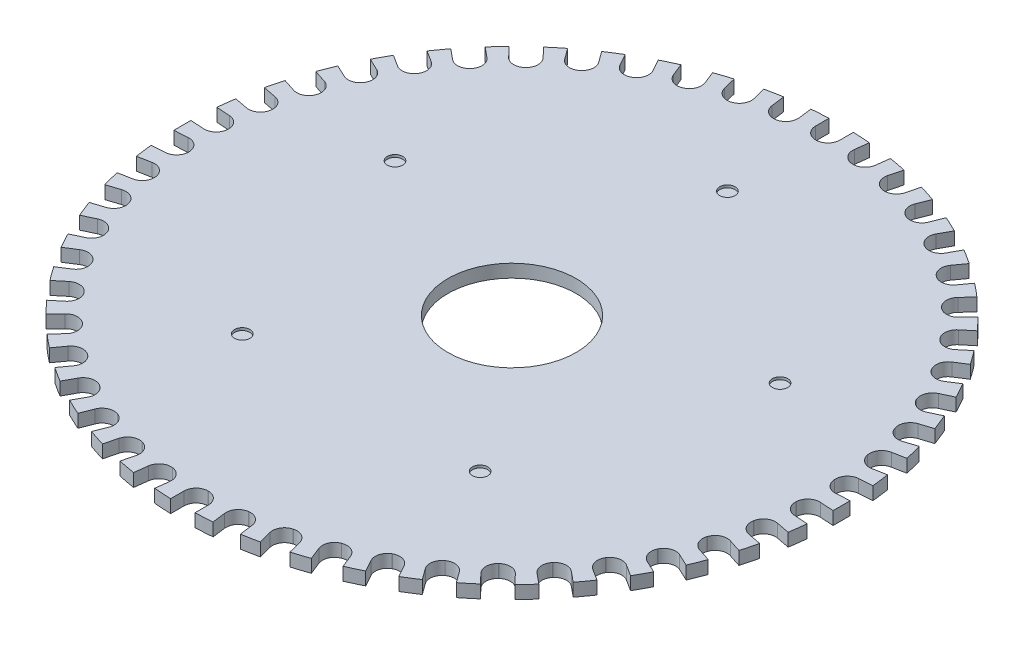
from build123d import *

# Parameters (mm, degrees)
RESSALTO_EXTRUS_O1_DEPTH = 0.2529
ESBO_O2_R                = 2.5
CORTE_EXTRUS_O1_DEPTH    = 19.173605411
ESBO_O3_R                = 0.3
CORTE_EXTRUS_O2_DEPTH    = 0.1


with BuildPart() as part:
    # Esboço1 → Ressalto-extrusão1 (new, symmetric)
    with BuildSketch(Plane(origin=(0, 0, 0), x_dir=(1, 0, 0), z_dir=(0, 1, 0))):
        with BuildLine():
            Line((1.067890513, 12.283014119), (1.133192992, 12.79993647))
            ThreePointArc((1.133192992, 12.79993647), (0.801864568, 12.824956655), (0.47, 12.841401793))
            Line((0.47, 12.841401793), (0.47, 12.320001055))
            ThreePointArc((0.47, 12.320001055), (0.332340187, 11.987660868), (0, 11.850001055))
            Line((0, 11.850001055), (-0.01, 11.850001055))
            ThreePointArc((-0.01, 11.850001055), (-0.342340187, 11.987660868), (-0.48, 12.320001055))
            Line((-0.48, 12.320001055), (-0.48, 12.84103189))
            ThreePointArc((-0.48, 12.84103189), (-0.811851661, 12.824328321), (-1.143160501, 12.799050124))
            Line((-1.143160501, 12.799050124), (-1.07781166, 12.281760787))
            ThreePointArc((-1.07781166, 12.281760787), (-1.172732714, 11.934787852), (-1.48519895, 11.756560257))
            Line((-1.48519895, 11.756560257), (-1.495120097, 11.755306925))
            ThreePointArc((-1.495120097, 11.755306925), (-1.842093032, 11.850227979), (-2.020320626, 12.162694215))
            Line((-2.020320626, 12.162694215), (-2.085623106, 12.679616566))
            ThreePointArc((-2.085623106, 12.679616566), (-2.412764505, 12.621452668), (-2.738292677, 12.554849789))
            Line((-2.738292677, 12.554849789), (-2.608625586, 12.049829814))
            ThreePointArc((-2.608625586, 12.049829814), (-2.65931092, 11.693696101), (-2.946975425, 11.477711481))
            Line((-2.946975425, 11.477711481), (-2.956661257, 11.475224582))
            ThreePointArc((-2.956661257, 11.475224582), (-3.312794969, 11.525909915), (-3.52877959, 11.813574421))
            Line((-3.52877959, 11.813574421), (-3.658354689, 12.318236114))
            ThreePointArc((-3.658354689, 12.318236114), (-3.975626611, 12.219529166), (-4.290240342, 12.112651972))
            Line((-4.290240342, 12.112651972), (-4.098299929, 11.627865827))
            ThreePointArc((-4.098299929, 11.627865827), (-4.103950203, 11.268187778), (-4.362276338, 11.017852339))
            Line((-4.362276338, 11.017852339), (-4.371574102, 11.014171093))
            ThreePointArc((-4.371574102, 11.014171093), (-4.731252151, 11.019821367), (-4.981587591, 11.278147502))
            Line((-4.981587591, 11.278147502), (-5.173391834, 11.762589721))
            ThreePointArc((-5.173391834, 11.762589721), (-5.475790711, 11.62489639), (-5.774528355, 11.479430399))
            Line((-5.774528355, 11.479430399), (-5.523341633, 11.022523449))
            ThreePointArc((-5.523341633, 11.022523449), (-5.483867741, 10.664973403), (-5.708781546, 10.384235083))
            Line((-5.708781546, 10.384235083), (-5.717544613, 10.379417546))
            ThreePointArc((-5.717544613, 10.379417546), (-6.07509466, 10.339943654), (-6.35583298, 10.564857459))
            Line((-6.35583298, 10.564857459), (-6.606841499, 11.02144026))
            ThreePointArc((-6.606841499, 11.02144026), (-6.88959832, 10.846932054), (-7.167748605, 10.66517135))
            Line((-7.167748605, 10.66517135), (-6.861276941, 10.243349293))
            ThreePointArc((-6.861276941, 10.243349293), (-6.777301408, 9.893566026), (-6.96525586, 9.586852237))
            Line((-6.96525586, 9.586852237), (-6.97334603, 9.580974384))
            ThreePointArc((-6.97334603, 9.580974384), (-7.323129297, 9.496998851), (-7.629843086, 9.684953303))
            Line((-7.629843086, 9.684953303), (-7.936097326, 10.106476103))
            ThreePointArc((-7.936097326, 10.106476103), (-8.194752848, 9.897905119), (-8.447929178, 9.682716179))
            Line((-8.447929178, 9.682716179), (-8.091005812, 9.302631399))
            ThreePointArc((-8.091005812, 9.302631399), (-7.963852984, 8.966131202), (-8.111883927, 8.638279004))
            Line((-8.111883927, 8.638279004), (-8.119173614, 8.631433533))
            ThreePointArc((-8.119173614, 8.631433533), (-8.45567381, 8.504280704), (-8.783526008, 8.652311648))
            Line((-8.783526008, 8.652311648), (-9.140196159, 9.032126781))
            ThreePointArc((-9.140196159, 9.032126781), (-9.370671229, 8.792782309), (-9.594880862, 8.547558789))
            Line((-9.594880862, 8.547558789), (-9.193134689, 8.21520545))
            ThreePointArc((-9.193134689, 8.21520545), (-9.02480984, 7.897295133), (-9.13058274, 7.553474951))
            Line((-9.13058274, 7.553474951), (-9.13695698, 7.545769818))
            ThreePointArc((-9.13695698, 7.545769818), (-9.454867296, 7.37744497), (-9.798687479, 7.48321787))
            Line((-9.798687479, 7.48321787), (-10.200148637, 7.815335423))
            ThreePointArc((-10.200148637, 7.815335423), (-10.398808526, 7.548992068), (-10.590515542, 7.277601291))
            Line((-10.590515542, 7.277601291), (-10.150282339, 6.998220804))
            ThreePointArc((-10.150282339, 6.998220804), (-9.943440055, 6.703914003), (-10.005286808, 6.349548086))
            Line((-10.005286808, 6.349548086), (-10.010645076, 6.341104806))
            ThreePointArc((-10.010645076, 6.341104806), (-10.304951877, 6.134262522), (-10.659317794, 6.196109275))
            Line((-10.659317794, 6.196109275), (-11.099238679, 6.475291558))
            ThreePointArc((-11.099238679, 6.475291558), (-11.262950401, 6.186149713), (-11.419131467, 5.892871673))
            Line((-11.419131467, 5.892871673), (-10.947353974, 5.670870036))
            ThreePointArc((-10.947353974, 5.670870036), (-10.705256279, 5.404808144), (-10.722201526, 5.045485054))
            Line((-10.722201526, 5.045485054), (-10.726459319, 5.036436784))
            ThreePointArc((-10.726459319, 5.036436784), (-10.992521211, 4.794339089), (-11.351844301, 4.811284336))
            Line((-11.351844301, 4.811284336), (-11.823287096, 5.033128476))
            ThreePointArc((-11.823287096, 5.033128476), (-11.94946882, 4.725748082), (-12.067660866, 4.415207948))
            Line((-12.067660866, 4.415207948), (-11.571779297, 4.254086259))
            ThreePointArc((-11.571779297, 4.254086259), (-11.298244218, 4.020465232), (-11.270020721, 3.661851709))
            Line((-11.270020721, 3.661851709), (-11.273110891, 3.652341144))
            ThreePointArc((-11.273110891, 3.652341144), (-11.506731919, 3.378806065), (-11.865345441, 3.350582569))
            Line((-11.865345441, 3.350582569), (-12.360875212, 3.511589951))
            ThreePointArc((-12.360875212, 3.511589951), (-12.447536977, 3.19081858), (-12.525876045, 2.867913757))
            Line((-12.525876045, 2.867913757), (-12.013710747, 2.770213001))
            ThreePointArc((-12.013710747, 2.770213001), (-11.713052095, 2.572717181), (-11.640104957, 2.220468776))
            Line((-11.640104957, 2.220468776), (-11.64197877, 2.210645903))
            ThreePointArc((-11.64197877, 2.210645903), (-11.839474591, 1.909987251), (-12.191722996, 1.837040113))
            Line((-12.191722996, 1.837040113), (-12.703524943, 1.934671556))
            ThreePointArc((-12.703524943, 1.934671556), (-12.74930004, 1.605567963), (-12.786550675, 1.275390852))
            Line((-12.786550675, 1.275390852), (-12.266178803, 1.242651829))
            ThreePointArc((-12.266178803, 1.242651829), (-11.943138144, 1.084395844), (-11.826617785, 0.744067723))
            Line((-11.826617785, 0.744067723), (-11.82724569, 0.734087455))
            ThreePointArc((-11.82724569, 0.734087455), (-11.985501676, 0.411046797), (-12.325829796, 0.294526437))
            Line((-12.325829796, 0.294526437), (-12.845832496, 0.327242234))
            ThreePointArc((-12.845832496, 0.327242234), (-12.849999026, -0.00500342), (-12.845573764, -0.337245728))
            Line((-12.845573764, -0.337245728), (-12.325201891, -0.304506704))
            ThreePointArc((-12.325201891, -0.304506704), (-11.98487377, -0.421027064), (-11.826617785, -0.744067723))
            Line((-11.826617785, -0.744067723), (-11.825989879, -0.75404799))
            ThreePointArc((-11.825989879, -0.75404799), (-11.942510239, -1.094376111), (-12.265550898, -1.252632096))
            Line((-12.265550898, -1.252632096), (-12.785553597, -1.285347893))
            ThreePointArc((-12.785553597, -1.285347893), (-12.748045851, -1.615495895), (-12.70201448, -1.944563741))
            Line((-12.70201448, -1.944563741), (-12.189849183, -1.846862986))
            ThreePointArc((-12.189849183, -1.846862986), (-11.837600778, -1.919810123), (-11.640104957, -2.220468776))
            Line((-11.640104957, -2.220468776), (-11.638231144, -2.230291648))
            ThreePointArc((-11.638231144, -2.230291648), (-11.711178282, -2.582540053), (-12.011836934, -2.780035874))
            Line((-12.011836934, -2.780035874), (-12.523638881, -2.877667317))
            ThreePointArc((-12.523638881, -2.877667317), (-12.445048377, -3.200511036), (-12.358136841, -3.521214823))
            Line((-12.358136841, -3.521214823), (-11.862255271, -3.360093134))
            ThreePointArc((-11.862255271, -3.360093134), (-11.503641749, -3.38831663), (-11.270020721, -3.661851709))
            Line((-11.270020721, -3.661851709), (-11.266930551, -3.671362274))
            ThreePointArc((-11.266930551, -3.671362274), (-11.295154048, -4.029975797), (-11.568689127, -4.263596824))
            Line((-11.568689127, -4.263596824), (-12.064218898, -4.424604207))
            ThreePointArc((-12.064218898, -4.424604207), (-11.945785056, -4.735052205), (-11.819364001, -5.042334243))
            Line((-11.819364001, -5.042334243), (-11.347586508, -4.820332607))
            ThreePointArc((-11.347586508, -4.820332607), (-10.988263418, -4.80338736), (-10.722201526, -5.045485054))
            Line((-10.722201526, -5.045485054), (-10.717943733, -5.054533325))
            ThreePointArc((-10.717943733, -5.054533325), (-10.700998487, -5.413856414), (-10.943096181, -5.679918306))
            Line((-10.943096181, -5.679918306), (-11.414538976, -5.901762446))
            ThreePointArc((-11.414538976, -5.901762446), (-11.258129569, -6.194918773), (-11.09419273, -6.483933041))
            Line((-11.09419273, -6.483933041), (-10.653959526, -6.204552554))
            ThreePointArc((-10.653959526, -6.204552554), (-10.299593609, -6.142705801), (-10.005286808, -6.349548086))
            Line((-10.005286808, -6.349548086), (-9.99992854, -6.357991365))
            ThreePointArc((-9.99992854, -6.357991365), (-9.938081787, -6.712357282), (-10.144924071, -7.006664084))
            Line((-10.144924071, -7.006664084), (-10.584844955, -7.285846366))
            ThreePointArc((-10.584844955, -7.285846366), (-10.392926653, -7.557087771), (-10.194059412, -7.823276341))
            Line((-10.194059412, -7.823276341), (-9.792313239, -7.490923002))
            ThreePointArc((-9.792313239, -7.490923002), (-9.448493057, -7.385150103), (-9.13058274, -7.553474951))
            Line((-9.13058274, -7.553474951), (-9.1242085, -7.561180083))
            ThreePointArc((-9.1242085, -7.561180083), (-9.018435601, -7.905000266), (-9.186760449, -8.222910583))
            Line((-9.186760449, -8.222910583), (-9.588221607, -8.555028136))
            ThreePointArc((-9.588221607, -8.555028136), (-9.363821076, -8.80007698), (-9.133159688, -9.039241899))
            Line((-9.133159688, -9.039241899), (-8.776236322, -8.659157119))
            ThreePointArc((-8.776236322, -8.659157119), (-8.448384124, -8.511126175), (-8.111883927, -8.638279004))
            Line((-8.111883927, -8.638279004), (-8.104594241, -8.645124475))
            ThreePointArc((-8.104594241, -8.645124475), (-7.956563297, -8.972976673), (-8.083716126, -9.30947687))
            Line((-8.083716126, -9.30947687), (-8.440386276, -9.689292002))
            ThreePointArc((-8.440386276, -9.689292002), (-8.187042446, -9.904283719), (-7.92822458, -10.112653213))
            Line((-7.92822458, -10.112653213), (-7.621752916, -9.690831156))
            ThreePointArc((-7.621752916, -9.690831156), (-7.315039127, -9.502876704), (-6.96525586, -9.586852237))
            Line((-6.96525586, -9.586852237), (-6.95716569, -9.592730089))
            ThreePointArc((-6.95716569, -9.592730089), (-6.769211238, -9.899443878), (-6.853186771, -10.249227145))
            Line((-6.853186771, -10.249227145), (-7.159441012, -10.670749945))
            ThreePointArc((-7.159441012, -10.670749945), (-6.881149267, -10.852293986), (-6.598256634, -11.026581945))
            Line((-6.598256634, -11.026581945), (-6.347069913, -10.569674996))
            ThreePointArc((-6.347069913, -10.569674996), (-6.066331593, -10.34476119), (-5.708781546, -10.384235083))
            Line((-5.708781546, -10.384235083), (-5.700018479, -10.38905262))
            ThreePointArc((-5.700018479, -10.38905262), (-5.475104674, -10.669790939), (-5.514578567, -11.027340986))
            Line((-5.514578567, -11.027340986), (-5.765587086, -11.483923787))
            ThreePointArc((-5.765587086, -11.483923787), (-5.466736253, -11.629157095), (-5.164230239, -11.766614893))
            Line((-5.164230239, -11.766614893), (-4.972289826, -11.281828747))
            ThreePointArc((-4.972289826, -11.281828747), (-4.721954386, -11.023502613), (-4.362276338, -11.017852339))
            Line((-4.362276338, -11.017852339), (-4.352978573, -11.021533584))
            ThreePointArc((-4.352978573, -11.021533584), (-4.094652438, -11.271869024), (-4.089002164, -11.631547072))
            Line((-4.089002164, -11.631547072), (-4.280806407, -12.115989291))
            ThreePointArc((-4.280806407, -12.115989291), (-3.966109542, -12.22262145), (-3.648760849, -12.321081295))
            Line((-3.648760849, -12.321081295), (-3.519093758, -11.81606132))
            ThreePointArc((-3.519093758, -11.81606132), (-3.303109138, -11.528396814), (-2.946975425, -11.477711481))
            Line((-2.946975425, -11.477711481), (-2.937289594, -11.48019838))
            ThreePointArc((-2.937289594, -11.48019838), (-2.649625088, -11.696183), (-2.598939755, -12.052316713))
            Line((-2.598939755, -12.052316713), (-2.728514854, -12.556978406))
            ThreePointArc((-2.728514854, -12.556978406), (-2.402934915, -12.623327762), (-2.07574832, -12.681236884))
            Line((-2.07574832, -12.681236884), (-2.010399479, -12.163947547))
            ThreePointArc((-2.010399479, -12.163947547), (-1.832171885, -11.851481311), (-1.48519895, -11.756560257))
            Line((-1.48519895, -11.756560257), (-1.475277803, -11.757813589))
            ThreePointArc((-1.475277803, -11.757813589), (-1.162811567, -11.936041184), (-1.067890513, -12.283014119))
            Line((-1.067890513, -12.283014119), (-1.133192992, -12.79993647))
            ThreePointArc((-1.133192992, -12.79993647), (-0.801864568, -12.824956655), (-0.47, -12.841401793))
            Line((-0.47, -12.841401793), (-0.47, -12.320001055))
            ThreePointArc((-0.47, -12.320001055), (-0.332340187, -11.987660868), (0, -11.850001055))
            Line((0, -11.850001055), (0.01, -11.850001055))
            ThreePointArc((0.01, -11.850001055), (0.342340187, -11.987660868), (0.48, -12.320001055))
            Line((0.48, -12.320001055), (0.48, -12.84103189))
            ThreePointArc((0.48, -12.84103189), (0.811851661, -12.824328321), (1.143160501, -12.799050124))
            Line((1.143160501, -12.799050124), (1.07781166, -12.281760787))
            ThreePointArc((1.07781166, -12.281760787), (1.172732714, -11.934787852), (1.48519895, -11.756560257))
            Line((1.48519895, -11.756560257), (1.495120097, -11.755306925))
            ThreePointArc((1.495120097, -11.755306925), (1.842093032, -11.850227979), (2.020320626, -12.162694215))
            Line((2.020320626, -12.162694215), (2.085623106, -12.679616566))
            ThreePointArc((2.085623106, -12.679616566), (2.412764505, -12.621452668), (2.738292677, -12.554849789))
            Line((2.738292677, -12.554849789), (2.608625586, -12.049829814))
            ThreePointArc((2.608625586, -12.049829814), (2.65931092, -11.693696101), (2.946975425, -11.477711481))
            Line((2.946975425, -11.477711481), (2.956661257, -11.475224582))
            ThreePointArc((2.956661257, -11.475224582), (3.312794969, -11.525909915), (3.52877959, -11.813574421))
            Line((3.52877959, -11.813574421), (3.658354689, -12.318236114))
            ThreePointArc((3.658354689, -12.318236114), (3.975626611, -12.219529166), (4.290240342, -12.112651972))
            Line((4.290240342, -12.112651972), (4.098299929, -11.627865827))
            ThreePointArc((4.098299929, -11.627865827), (4.103950203, -11.268187778), (4.362276338, -11.017852339))
            Line((4.362276338, -11.017852339), (4.371574102, -11.014171093))
            ThreePointArc((4.371574102, -11.014171093), (4.731252151, -11.019821367), (4.981587591, -11.278147502))
            Line((4.981587591, -11.278147502), (5.173391834, -11.762589721))
            ThreePointArc((5.173391834, -11.762589721), (5.475790711, -11.62489639), (5.774528355, -11.479430399))
            Line((5.774528355, -11.479430399), (5.523341633, -11.022523449))
            ThreePointArc((5.523341633, -11.022523449), (5.483867741, -10.664973403), (5.708781546, -10.384235083))
            Line((5.708781546, -10.384235083), (5.717544613, -10.379417546))
            ThreePointArc((5.717544613, -10.379417546), (6.07509466, -10.339943654), (6.35583298, -10.564857459))
            Line((6.35583298, -10.564857459), (6.606841499, -11.02144026))
            ThreePointArc((6.606841499, -11.02144026), (6.88959832, -10.846932054), (7.167748605, -10.66517135))
            Line((7.167748605, -10.66517135), (6.861276941, -10.243349293))
            ThreePointArc((6.861276941, -10.243349293), (6.777301408, -9.893566026), (6.96525586, -9.586852237))
            Line((6.96525586, -9.586852237), (6.97334603, -9.580974384))
            ThreePointArc((6.97334603, -9.580974384), (7.323129297, -9.496998851), (7.629843086, -9.684953303))
            Line((7.629843086, -9.684953303), (7.936097326, -10.106476103))
            ThreePointArc((7.936097326, -10.106476103), (8.194752848, -9.897905119), (8.447929178, -9.682716179))
            Line((8.447929178, -9.682716179), (8.091005812, -9.302631399))
            ThreePointArc((8.091005812, -9.302631399), (7.963852984, -8.966131202), (8.111883927, -8.638279004))
            Line((8.111883927, -8.638279004), (8.119173614, -8.631433533))
            ThreePointArc((8.119173614, -8.631433533), (8.45567381, -8.504280704), (8.783526008, -8.652311648))
            Line((8.783526008, -8.652311648), (9.140196159, -9.032126781))
            ThreePointArc((9.140196159, -9.032126781), (9.370671229, -8.792782309), (9.594880862, -8.547558789))
            Line((9.594880862, -8.547558789), (9.193134689, -8.21520545))
            ThreePointArc((9.193134689, -8.21520545), (9.02480984, -7.897295133), (9.13058274, -7.553474951))
            Line((9.13058274, -7.553474951), (9.13695698, -7.545769818))
            ThreePointArc((9.13695698, -7.545769818), (9.454867296, -7.37744497), (9.798687479, -7.48321787))
            Line((9.798687479, -7.48321787), (10.200148637, -7.815335423))
            ThreePointArc((10.200148637, -7.815335423), (10.398808526, -7.548992068), (10.590515542, -7.277601291))
            Line((10.590515542, -7.277601291), (10.150282339, -6.998220804))
            ThreePointArc((10.150282339, -6.998220804), (9.943440055, -6.703914003), (10.005286808, -6.349548086))
            Line((10.005286808, -6.349548086), (10.010645076, -6.341104806))
            ThreePointArc((10.010645076, -6.341104806), (10.304951877, -6.134262522), (10.659317794, -6.196109275))
            Line((10.659317794, -6.196109275), (11.099238679, -6.475291558))
            ThreePointArc((11.099238679, -6.475291558), (11.262950401, -6.186149713), (11.419131467, -5.892871673))
            Line((11.419131467, -5.892871673), (10.947353974, -5.670870036))
            ThreePointArc((10.947353974, -5.670870036), (10.705256279, -5.404808144), (10.722201526, -5.045485054))
            Line((10.722201526, -5.045485054), (10.726459319, -5.036436784))
            ThreePointArc((10.726459319, -5.036436784), (10.992521211, -4.794339089), (11.351844301, -4.811284336))
            Line((11.351844301, -4.811284336), (11.823287096, -5.033128476))
            ThreePointArc((11.823287096, -5.033128476), (11.94946882, -4.725748082), (12.067660866, -4.415207948))
            Line((12.067660866, -4.415207948), (11.571779297, -4.254086259))
            ThreePointArc((11.571779297, -4.254086259), (11.298244218, -4.020465232), (11.270020721, -3.661851709))
            Line((11.270020721, -3.661851709), (11.273110891, -3.652341144))
            ThreePointArc((11.273110891, -3.652341144), (11.506731919, -3.378806065), (11.865345441, -3.350582569))
            Line((11.865345441, -3.350582569), (12.360875212, -3.511589951))
            ThreePointArc((12.360875212, -3.511589951), (12.447536977, -3.19081858), (12.525876045, -2.867913757))
            Line((12.525876045, -2.867913757), (12.013710747, -2.770213001))
            ThreePointArc((12.013710747, -2.770213001), (11.713052095, -2.572717181), (11.640104957, -2.220468776))
            Line((11.640104957, -2.220468776), (11.64197877, -2.210645903))
            ThreePointArc((11.64197877, -2.210645903), (11.839474591, -1.909987251), (12.191722996, -1.837040113))
            Line((12.191722996, -1.837040113), (12.703524943, -1.934671556))
            ThreePointArc((12.703524943, -1.934671556), (12.74930004, -1.605567963), (12.786550675, -1.275390852))
            Line((12.786550675, -1.275390852), (12.266178803, -1.242651829))
            ThreePointArc((12.266178803, -1.242651829), (11.943138144, -1.084395844), (11.826617785, -0.744067723))
            Line((11.826617785, -0.744067723), (11.82724569, -0.734087455))
            ThreePointArc((11.82724569, -0.734087455), (11.985501676, -0.411046797), (12.325829796, -0.294526437))
            Line((12.325829796, -0.294526437), (12.845832496, -0.327242234))
            ThreePointArc((12.845832496, -0.327242234), (12.848958082, -0.163634385), (12.85, 0))
            ThreePointArc((12.85, 0), (12.848893393, 0.168637386), (12.845573764, 0.337245728))
            Line((12.845573764, 0.337245728), (12.325201891, 0.304506704))
            ThreePointArc((12.325201891, 0.304506704), (11.98487377, 0.421027064), (11.826617785, 0.744067723))
            Line((11.826617785, 0.744067723), (11.825989879, 0.75404799))
            ThreePointArc((11.825989879, 0.75404799), (11.942510239, 1.094376111), (12.265550898, 1.252632096))
            Line((12.265550898, 1.252632096), (12.785553597, 1.285347893))
            ThreePointArc((12.785553597, 1.285347893), (12.748045851, 1.615495895), (12.70201448, 1.944563741))
            Line((12.70201448, 1.944563741), (12.189849183, 1.846862986))
            ThreePointArc((12.189849183, 1.846862986), (11.837600778, 1.919810123), (11.640104957, 2.220468776))
            Line((11.640104957, 2.220468776), (11.638231144, 2.230291648))
            ThreePointArc((11.638231144, 2.230291648), (11.711178282, 2.582540053), (12.011836934, 2.780035874))
            Line((12.011836934, 2.780035874), (12.523638881, 2.877667317))
            ThreePointArc((12.523638881, 2.877667317), (12.445048377, 3.200511036), (12.358136841, 3.521214823))
            Line((12.358136841, 3.521214823), (11.862255271, 3.360093134))
            ThreePointArc((11.862255271, 3.360093134), (11.503641749, 3.38831663), (11.270020721, 3.661851709))
            Line((11.270020721, 3.661851709), (11.266930551, 3.671362274))
            ThreePointArc((11.266930551, 3.671362274), (11.295154048, 4.029975797), (11.568689127, 4.263596824))
            Line((11.568689127, 4.263596824), (12.064218898, 4.424604207))
            ThreePointArc((12.064218898, 4.424604207), (11.945785056, 4.735052205), (11.819364001, 5.042334243))
            Line((11.819364001, 5.042334243), (11.347586508, 4.820332607))
            ThreePointArc((11.347586508, 4.820332607), (10.988263418, 4.80338736), (10.722201526, 5.045485054))
            Line((10.722201526, 5.045485054), (10.717943733, 5.054533325))
            ThreePointArc((10.717943733, 5.054533325), (10.700998487, 5.413856414), (10.943096181, 5.679918306))
            Line((10.943096181, 5.679918306), (11.414538976, 5.901762446))
            ThreePointArc((11.414538976, 5.901762446), (11.258129569, 6.194918773), (11.09419273, 6.483933041))
            Line((11.09419273, 6.483933041), (10.653959526, 6.204552554))
            ThreePointArc((10.653959526, 6.204552554), (10.299593609, 6.142705801), (10.005286808, 6.349548086))
            Line((10.005286808, 6.349548086), (9.99992854, 6.357991365))
            ThreePointArc((9.99992854, 6.357991365), (9.938081787, 6.712357282), (10.144924071, 7.006664084))
            Line((10.144924071, 7.006664084), (10.584844955, 7.285846366))
            ThreePointArc((10.584844955, 7.285846366), (10.392926653, 7.557087771), (10.194059412, 7.823276341))
            Line((10.194059412, 7.823276341), (9.792313239, 7.490923002))
            ThreePointArc((9.792313239, 7.490923002), (9.448493057, 7.385150103), (9.13058274, 7.553474951))
            Line((9.13058274, 7.553474951), (9.1242085, 7.561180083))
            ThreePointArc((9.1242085, 7.561180083), (9.018435601, 7.905000266), (9.186760449, 8.222910583))
            Line((9.186760449, 8.222910583), (9.588221607, 8.555028136))
            ThreePointArc((9.588221607, 8.555028136), (9.363821076, 8.80007698), (9.133159688, 9.039241899))
            Line((9.133159688, 9.039241899), (8.776236322, 8.659157119))
            ThreePointArc((8.776236322, 8.659157119), (8.448384124, 8.511126175), (8.111883927, 8.638279004))
            Line((8.111883927, 8.638279004), (8.104594241, 8.645124475))
            ThreePointArc((8.104594241, 8.645124475), (7.956563297, 8.972976673), (8.083716126, 9.30947687))
            Line((8.083716126, 9.30947687), (8.440386276, 9.689292002))
            ThreePointArc((8.440386276, 9.689292002), (8.187042446, 9.904283719), (7.92822458, 10.112653213))
            Line((7.92822458, 10.112653213), (7.621752916, 9.690831156))
            ThreePointArc((7.621752916, 9.690831156), (7.315039127, 9.502876704), (6.96525586, 9.586852237))
            Line((6.96525586, 9.586852237), (6.95716569, 9.592730089))
            ThreePointArc((6.95716569, 9.592730089), (6.769211238, 9.899443878), (6.853186771, 10.249227145))
            Line((6.853186771, 10.249227145), (7.159441012, 10.670749945))
            ThreePointArc((7.159441012, 10.670749945), (6.881149267, 10.852293986), (6.598256634, 11.026581945))
            Line((6.598256634, 11.026581945), (6.347069913, 10.569674996))
            ThreePointArc((6.347069913, 10.569674996), (6.066331593, 10.34476119), (5.708781546, 10.384235083))
            Line((5.708781546, 10.384235083), (5.700018479, 10.38905262))
            ThreePointArc((5.700018479, 10.38905262), (5.475104674, 10.669790939), (5.514578567, 11.027340986))
            Line((5.514578567, 11.027340986), (5.765587086, 11.483923787))
            ThreePointArc((5.765587086, 11.483923787), (5.466736253, 11.629157095), (5.164230239, 11.766614893))
            Line((5.164230239, 11.766614893), (4.972289826, 11.281828747))
            ThreePointArc((4.972289826, 11.281828747), (4.721954386, 11.023502613), (4.362276338, 11.017852339))
            Line((4.362276338, 11.017852339), (4.352978573, 11.021533584))
            ThreePointArc((4.352978573, 11.021533584), (4.094652438, 11.271869024), (4.089002164, 11.631547072))
            Line((4.089002164, 11.631547072), (4.280806407, 12.115989291))
            ThreePointArc((4.280806407, 12.115989291), (3.966109542, 12.22262145), (3.648760849, 12.321081295))
            Line((3.648760849, 12.321081295), (3.519093758, 11.81606132))
            ThreePointArc((3.519093758, 11.81606132), (3.303109138, 11.528396814), (2.946975425, 11.477711481))
            Line((2.946975425, 11.477711481), (2.937289594, 11.48019838))
            ThreePointArc((2.937289594, 11.48019838), (2.649625088, 11.696183), (2.598939755, 12.052316713))
            Line((2.598939755, 12.052316713), (2.728514854, 12.556978406))
            ThreePointArc((2.728514854, 12.556978406), (2.402934915, 12.623327762), (2.07574832, 12.681236884))
            Line((2.07574832, 12.681236884), (2.010399479, 12.163947547))
            ThreePointArc((2.010399479, 12.163947547), (1.832171885, 11.851481311), (1.48519895, 11.756560257))
            Line((1.48519895, 11.756560257), (1.475277803, 11.757813589))
            ThreePointArc((1.475277803, 11.757813589), (1.162811567, 11.936041184), (1.067890513, 12.283014119))
        make_face()
    extrude(amount=RESSALTO_EXTRUS_O1_DEPTH, both=True)

    # Esboço2 → Corte-extrusão1 (cut, through all)
    with BuildSketch(Plane(origin=(0, 0.2529, 0), x_dir=(1, 0, 0), z_dir=(0, 1, 0))):
        Circle(ESBO_O2_R)
    extrude(amount=-CORTE_EXTRUS_O1_DEPTH, mode=Mode.SUBTRACT)

    # Esboço3 → Corte-extrusão2 (cut)
    with BuildSketch(Plane(origin=(0, 0.2529, 0), x_dir=(1, 0, 0), z_dir=(0, 1, 0))):
        with Locations((0, 8.4)):
            Circle(ESBO_O3_R)
        with Locations((7.507830351, 2.945241957)):
            Circle(ESBO_O3_R)
        with Locations((4.640094339, -5.880741957)):
            Circle(ESBO_O3_R)
        with Locations((-4.640094339, -5.880741957)):
            Circle(ESBO_O3_R)
        with Locations((-7.507830351, 2.945241957)):
            Circle(ESBO_O3_R)
    corte_extrus_o2 = extrude(amount=-CORTE_EXTRUS_O2_DEPTH, mode=Mode.SUBTRACT)

    # Espelhar1: Corte-extrusão2 across plane
    add(corte_extrus_o2.mirror(Plane.ZX), mode=Mode.SUBTRACT)


solid = part.part
